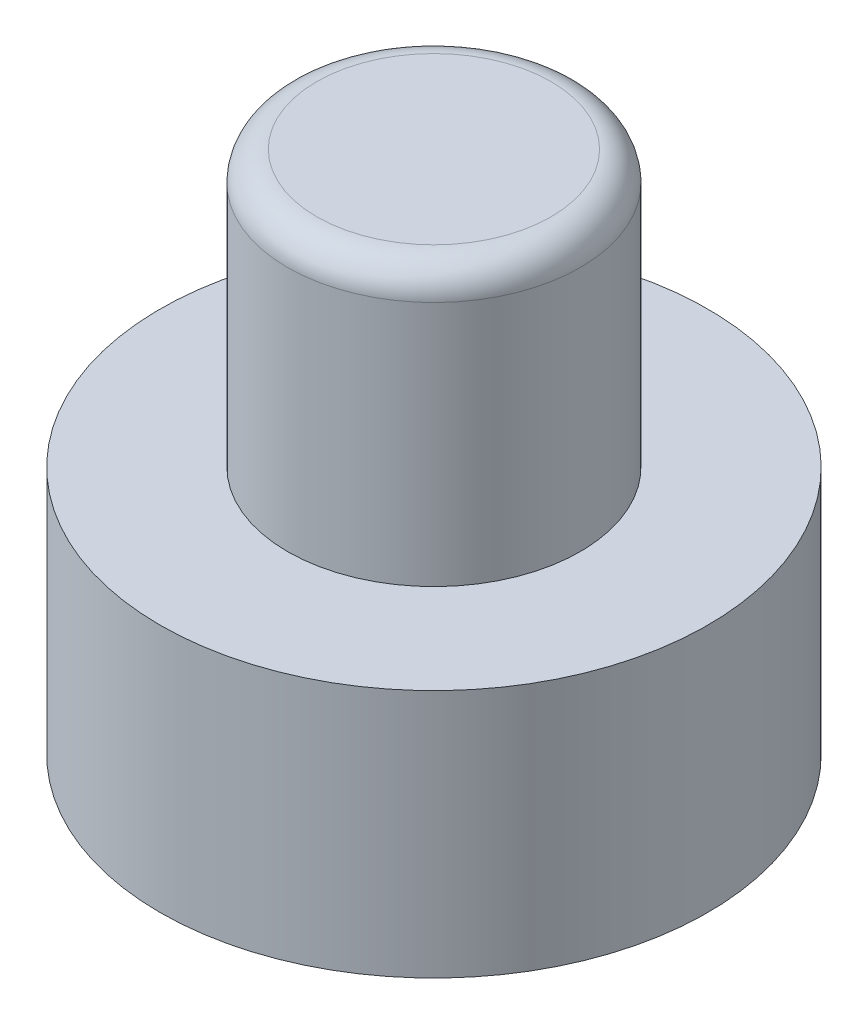
from build123d import *

# Parameters (mm, degrees)
SKETCH1_R           = 4.675
BOSS_EXTRUDE1_DEPTH = 4.25
SKETCH2_R           = 2.5
BOSS_EXTRUDE2_DEPTH = 4.7
FILLET1_R           = 0.5


with BuildPart() as part:
    # Sketch1 → Boss-Extrude1 (new body)
    with BuildSketch(Plane(origin=(0, 0, 0), x_dir=(1, 0, 0), z_dir=(0, 1, 0))):
        Circle(SKETCH1_R)
    extrude(amount=BOSS_EXTRUDE1_DEPTH)

    # Sketch2 → Boss-Extrude2 (add)
    with BuildSketch(Plane(origin=(0, 4.25, 0), x_dir=(1, 0, 0), z_dir=(0, 1, 0))):
        Circle(SKETCH2_R)
    extrude(amount=BOSS_EXTRUDE2_DEPTH)

    # Fillet1
    fillet1_edges = [part.edges().sort_by_distance(p)[0] for p in [
        (-2.5, 8.95, 0),
    ]]
    fillet(fillet1_edges, radius=FILLET1_R)


solid = part.part
